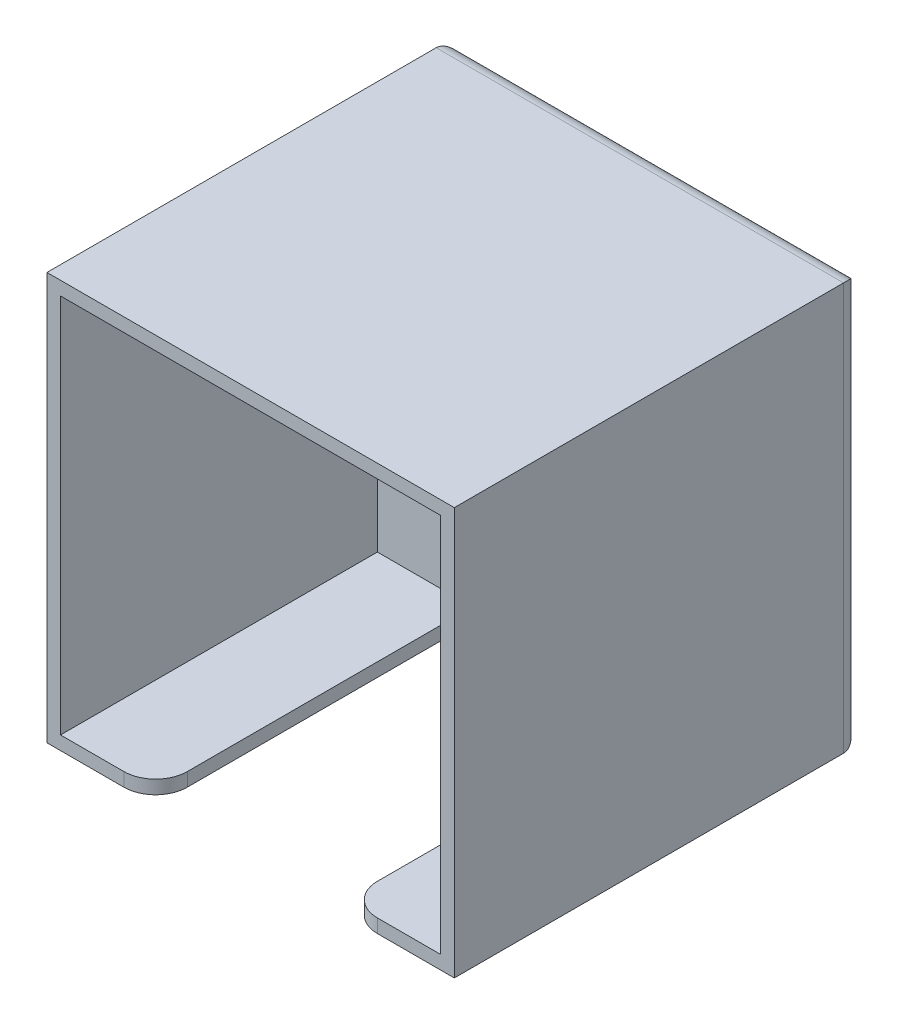
from build123d import *

# Parameters (mm, degrees)
SKETCH_2_W          = 45
SKETCH_2_H          = 45
EXTRUDE_1_DEPTH     = 45
SKETCH_3_W          = 42
SKETCH_3_H          = 42
CUT_EXTRUDE_1_DEPTH = 35
CUT_EXTRUDE_2_REACH = 69.5
SKETCH_4_W          = 21
SKETCH_4_H          = 35
FILLET_2_R          = 3.5
FILLET_3_R          = 2


with BuildPart() as part:
    # 草图2 → 凸台-拉伸1 (new body)
    with BuildSketch(Plane.XY):
        Rectangle(SKETCH_2_W, SKETCH_2_H)
    extrude(amount=EXTRUDE_1_DEPTH)

    # 草图3 → 切除-拉伸1 (cut)
    with BuildSketch(Plane.XY.offset(45)):
        Rectangle(SKETCH_3_W, SKETCH_3_H)
    extrude(amount=-CUT_EXTRUDE_1_DEPTH, mode=Mode.SUBTRACT)

    # 草图4 → 切除-拉伸2 (cut, up to next)
    with BuildSketch(Plane.XZ.offset(22.5), mode=Mode.PRIVATE) as cut_extrude_2_sk1:
        with Locations((0, 27.5)):
            Rectangle(SKETCH_4_W, SKETCH_4_H)
    cut_extrude_2_tool1 = extrude(cut_extrude_2_sk1.sketch, amount=-CUT_EXTRUDE_2_REACH, mode=Mode.PRIVATE) & part.part
    add(cut_extrude_2_tool1.solids().sort_by_distance((0, -22.5, 27.5))[0], mode=Mode.SUBTRACT)

    # 圆角2
    fillet_2_edges = [part.edges().sort_by_distance(p)[0] for p in [
        (-10.5, -21.75, 45),
        (10.5, -21.75, 45),
    ]]
    fillet(fillet_2_edges, radius=FILLET_2_R)

    # 圆角3
    fillet_3_edges = [part.edges().sort_by_distance(p)[0] for p in [
        (0, -22.5, 0),
        (-22.5, 0, 0),
        (0, 22.5, 0),
        (22.5, 0, 0),
    ]]
    fillet(fillet_3_edges, radius=FILLET_3_R)


solid = part.part
